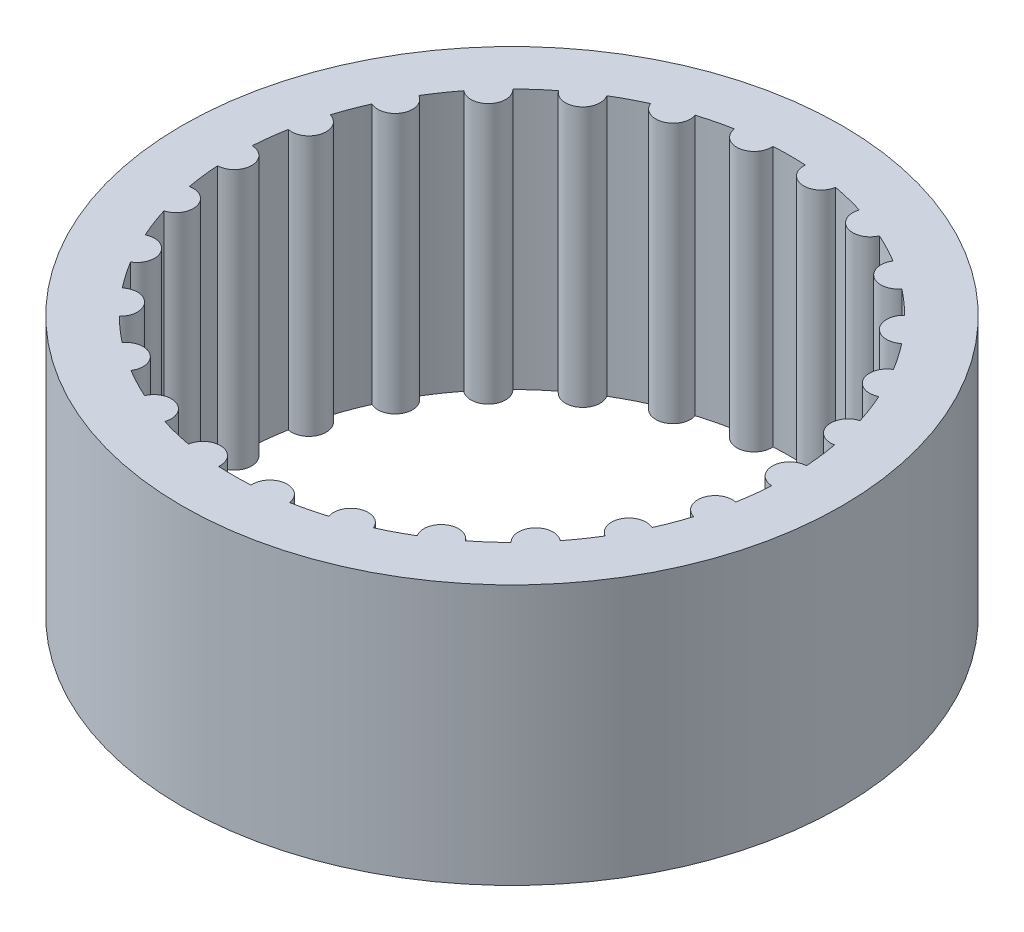
from build123d import *

# Parameters (mm, degrees)
BOSS_EXTRUDE1_DEPTH         = 10
BOSS_EXTRUDE1_DEPTH_BACK    = 10
SKETCH3_R                   = 1
BOSS_EXTRUDE1_2_DEPTH       = 10
BOSS_EXTRUDE1_2_DEPTH_BACK  = 10
SKETCH3_R_2                 = 0.999999994
BOSS_EXTRUDE1_3_DEPTH       = 10
BOSS_EXTRUDE1_3_DEPTH_BACK  = 10
BOSS_EXTRUDE1_4_DEPTH       = 10
BOSS_EXTRUDE1_4_DEPTH_BACK  = 10
BOSS_EXTRUDE1_5_DEPTH       = 10
BOSS_EXTRUDE1_5_DEPTH_BACK  = 10
BOSS_EXTRUDE1_6_DEPTH       = 10
BOSS_EXTRUDE1_6_DEPTH_BACK  = 10
BOSS_EXTRUDE1_7_DEPTH       = 10
BOSS_EXTRUDE1_7_DEPTH_BACK  = 10
BOSS_EXTRUDE1_8_DEPTH       = 10
BOSS_EXTRUDE1_8_DEPTH_BACK  = 10
BOSS_EXTRUDE1_9_DEPTH       = 10
BOSS_EXTRUDE1_9_DEPTH_BACK  = 10
BOSS_EXTRUDE1_10_DEPTH      = 10
BOSS_EXTRUDE1_10_DEPTH_BACK = 10
BOSS_EXTRUDE1_11_DEPTH      = 10
BOSS_EXTRUDE1_11_DEPTH_BACK = 10
BOSS_EXTRUDE1_12_DEPTH      = 10
BOSS_EXTRUDE1_12_DEPTH_BACK = 10
BOSS_EXTRUDE1_13_DEPTH      = 10
BOSS_EXTRUDE1_13_DEPTH_BACK = 10
BOSS_EXTRUDE1_14_DEPTH      = 10
BOSS_EXTRUDE1_14_DEPTH_BACK = 10
BOSS_EXTRUDE1_15_DEPTH      = 10
BOSS_EXTRUDE1_15_DEPTH_BACK = 10
BOSS_EXTRUDE1_16_DEPTH      = 10
BOSS_EXTRUDE1_16_DEPTH_BACK = 10
BOSS_EXTRUDE1_17_DEPTH      = 10
BOSS_EXTRUDE1_17_DEPTH_BACK = 10
BOSS_EXTRUDE1_18_DEPTH      = 10
BOSS_EXTRUDE1_18_DEPTH_BACK = 10
BOSS_EXTRUDE1_19_DEPTH      = 10
BOSS_EXTRUDE1_19_DEPTH_BACK = 10
BOSS_EXTRUDE1_20_DEPTH      = 10
BOSS_EXTRUDE1_20_DEPTH_BACK = 10
BOSS_EXTRUDE1_21_DEPTH      = 10
BOSS_EXTRUDE1_21_DEPTH_BACK = 10
BOSS_EXTRUDE1_22_DEPTH      = 10
BOSS_EXTRUDE1_22_DEPTH_BACK = 10
BOSS_EXTRUDE1_23_DEPTH      = 10
BOSS_EXTRUDE1_23_DEPTH_BACK = 10
BOSS_EXTRUDE1_24_DEPTH      = 10
BOSS_EXTRUDE1_24_DEPTH_BACK = 10
BOSS_EXTRUDE1_25_DEPTH      = 10
BOSS_EXTRUDE1_25_DEPTH_BACK = 10
BOSS_EXTRUDE1_26_DEPTH      = 10
BOSS_EXTRUDE1_26_DEPTH_BACK = 10
BOSS_EXTRUDE2_DEPTH         = 10
BOSS_EXTRUDE2_DEPTH_BACK    = 10
SKETCH4_R                   = 19
SKETCH4_R_2                 = 16
SKETCH5_R                   = 19
CUT_EXTRUDE2_DEPTH          = 2.5
SKETCH6_R                   = 19
CUT_EXTRUDE3_DEPTH          = 2.5


with BuildPart() as part:
    # Sketch3 → Boss-Extrude1 (new, two sides: drawn at the far end of the back side and taken through both)
    with BuildSketch(Plane(origin=(0, 0, 0), x_dir=(1, 0, 0), z_dir=(0, 1, 0)).offset(-BOSS_EXTRUDE1_DEPTH_BACK)):
        with Locations((15.5, 1.13e-07)):
            Circle(SKETCH3_R)
    extrude(amount=BOSS_EXTRUDE1_DEPTH + BOSS_EXTRUDE1_DEPTH_BACK)



with BuildPart() as body_2:
    # Sketch3 → Boss-Extrude1 2 (new, two sides: drawn at the far end of the back side and taken through both)
    with BuildSketch(Plane(origin=(0, 0, 0), x_dir=(1, 0, 0), z_dir=(0, 1, 0)).offset(-BOSS_EXTRUDE1_2_DEPTH_BACK)):
        with Locations((15.035069079, -3.829050516)):
            Circle(SKETCH3_R_2)
    extrude(amount=BOSS_EXTRUDE1_2_DEPTH + BOSS_EXTRUDE1_2_DEPTH_BACK)


with BuildPart() as body_3:
    # Sketch3 → Boss-Extrude1 3 (new, two sides: drawn at the far end of the back side and taken through both)
    with BuildSketch(Plane(origin=(0, 0, 0), x_dir=(1, 0, 0), z_dir=(0, 1, 0)).offset(-BOSS_EXTRUDE1_3_DEPTH_BACK)):
        with Locations((13.66729641, -7.43557064)):
            Circle(SKETCH3_R)
    extrude(amount=BOSS_EXTRUDE1_3_DEPTH + BOSS_EXTRUDE1_3_DEPTH_BACK)


with BuildPart() as body_4:
    # Sketch3 → Boss-Extrude1 4 (new, two sides: drawn at the far end of the back side and taken through both)
    with BuildSketch(Plane(origin=(0, 0, 0), x_dir=(1, 0, 0), z_dir=(0, 1, 0)).offset(-BOSS_EXTRUDE1_4_DEPTH_BACK)):
        with Locations((11.476171971, -10.609962419)):
            Circle(SKETCH3_R)
    extrude(amount=BOSS_EXTRUDE1_4_DEPTH + BOSS_EXTRUDE1_4_DEPTH_BACK)


with BuildPart() as body_5:
    # Sketch3 → Boss-Extrude1 5 (new, two sides: drawn at the far end of the back side and taken through both)
    with BuildSketch(Plane(origin=(0, 0, 0), x_dir=(1, 0, 0), z_dir=(0, 1, 0)).offset(-BOSS_EXTRUDE1_5_DEPTH_BACK)):
        with Locations((8.589035948, -13.167741741)):
            Circle(SKETCH3_R)
    extrude(amount=BOSS_EXTRUDE1_5_DEPTH + BOSS_EXTRUDE1_5_DEPTH_BACK)


with BuildPart() as body_6:
    # Sketch3 → Boss-Extrude1 6 (new, two sides: drawn at the far end of the back side and taken through both)
    with BuildSketch(Plane(origin=(0, 0, 0), x_dir=(1, 0, 0), z_dir=(0, 1, 0)).offset(-BOSS_EXTRUDE1_6_DEPTH_BACK)):
        with Locations((5.173678193, -14.96025977)):
            Circle(SKETCH3_R)
    extrude(amount=BOSS_EXTRUDE1_6_DEPTH + BOSS_EXTRUDE1_6_DEPTH_BACK)


with BuildPart() as body_7:
    # Sketch3 → Boss-Extrude1 7 (new, two sides: drawn at the far end of the back side and taken through both)
    with BuildSketch(Plane(origin=(0, 0, 0), x_dir=(1, 0, 0), z_dir=(0, 1, 0)).offset(-BOSS_EXTRUDE1_7_DEPTH_BACK)):
        with Locations((1.428586884, -15.883341873)):
            Circle(SKETCH3_R)
    extrude(amount=BOSS_EXTRUDE1_7_DEPTH + BOSS_EXTRUDE1_7_DEPTH_BACK)


with BuildPart() as body_8:
    # Sketch3 → Boss-Extrude1 8 (new, two sides: drawn at the far end of the back side and taken through both)
    with BuildSketch(Plane(origin=(0, 0, 0), x_dir=(1, 0, 0), z_dir=(0, 1, 0)).offset(-BOSS_EXTRUDE1_8_DEPTH_BACK)):
        with Locations((-2.428586884, -15.883341873)):
            Circle(SKETCH3_R)
    extrude(amount=BOSS_EXTRUDE1_8_DEPTH + BOSS_EXTRUDE1_8_DEPTH_BACK)


with BuildPart() as body_9:
    # Sketch3 → Boss-Extrude1 9 (new, two sides: drawn at the far end of the back side and taken through both)
    with BuildSketch(Plane(origin=(0, 0, 0), x_dir=(1, 0, 0), z_dir=(0, 1, 0)).offset(-BOSS_EXTRUDE1_9_DEPTH_BACK)):
        with Locations((-6.173678193, -14.96025977)):
            Circle(SKETCH3_R)
    extrude(amount=BOSS_EXTRUDE1_9_DEPTH + BOSS_EXTRUDE1_9_DEPTH_BACK)


with BuildPart() as body_10:
    # Sketch3 → Boss-Extrude1 10 (new, two sides: drawn at the far end of the back side and taken through both)
    with BuildSketch(Plane(origin=(0, 0, 0), x_dir=(1, 0, 0), z_dir=(0, 1, 0)).offset(-BOSS_EXTRUDE1_10_DEPTH_BACK)):
        with Locations((-9.589035948, -13.167741741)):
            Circle(SKETCH3_R)
    extrude(amount=BOSS_EXTRUDE1_10_DEPTH + BOSS_EXTRUDE1_10_DEPTH_BACK)


with BuildPart() as body_11:
    # Sketch3 → Boss-Extrude1 11 (new, two sides: drawn at the far end of the back side and taken through both)
    with BuildSketch(Plane(origin=(0, 0, 0), x_dir=(1, 0, 0), z_dir=(0, 1, 0)).offset(-BOSS_EXTRUDE1_11_DEPTH_BACK)):
        with Locations((-12.476171971, -10.609962419)):
            Circle(SKETCH3_R)
    extrude(amount=BOSS_EXTRUDE1_11_DEPTH + BOSS_EXTRUDE1_11_DEPTH_BACK)


with BuildPart() as body_12:
    # Sketch3 → Boss-Extrude1 12 (new, two sides: drawn at the far end of the back side and taken through both)
    with BuildSketch(Plane(origin=(0, 0, 0), x_dir=(1, 0, 0), z_dir=(0, 1, 0)).offset(-BOSS_EXTRUDE1_12_DEPTH_BACK)):
        with Locations((-14.66729641, -7.43557064)):
            Circle(SKETCH3_R)
    extrude(amount=BOSS_EXTRUDE1_12_DEPTH + BOSS_EXTRUDE1_12_DEPTH_BACK)


with BuildPart() as body_13:
    # Sketch3 → Boss-Extrude1 13 (new, two sides: drawn at the far end of the back side and taken through both)
    with BuildSketch(Plane(origin=(0, 0, 0), x_dir=(1, 0, 0), z_dir=(0, 1, 0)).offset(-BOSS_EXTRUDE1_13_DEPTH_BACK)):
        with Locations((-16.035069079, -3.829050516)):
            Circle(SKETCH3_R)
    extrude(amount=BOSS_EXTRUDE1_13_DEPTH + BOSS_EXTRUDE1_13_DEPTH_BACK)


with BuildPart() as body_14:
    # Sketch3 → Boss-Extrude1 14 (new, two sides: drawn at the far end of the back side and taken through both)
    with BuildSketch(Plane(origin=(0, 0, 0), x_dir=(1, 0, 0), z_dir=(0, 1, 0)).offset(-BOSS_EXTRUDE1_14_DEPTH_BACK)):
        with Locations((-16.5, 1.13e-07)):
            Circle(SKETCH3_R)
    extrude(amount=BOSS_EXTRUDE1_14_DEPTH + BOSS_EXTRUDE1_14_DEPTH_BACK)


with BuildPart() as body_15:
    # Sketch3 → Boss-Extrude1 15 (new, two sides: drawn at the far end of the back side and taken through both)
    with BuildSketch(Plane(origin=(0, 0, 0), x_dir=(1, 0, 0), z_dir=(0, 1, 0)).offset(-BOSS_EXTRUDE1_15_DEPTH_BACK)):
        with Locations((-16.035069079, 3.829050742)):
            Circle(SKETCH3_R_2)
    extrude(amount=BOSS_EXTRUDE1_15_DEPTH + BOSS_EXTRUDE1_15_DEPTH_BACK)


with BuildPart() as body_16:
    # Sketch3 → Boss-Extrude1 16 (new, two sides: drawn at the far end of the back side and taken through both)
    with BuildSketch(Plane(origin=(0, 0, 0), x_dir=(1, 0, 0), z_dir=(0, 1, 0)).offset(-BOSS_EXTRUDE1_16_DEPTH_BACK)):
        with Locations((-14.66729641, 7.435570866)):
            Circle(SKETCH3_R)
    extrude(amount=BOSS_EXTRUDE1_16_DEPTH + BOSS_EXTRUDE1_16_DEPTH_BACK)


with BuildPart() as body_17:
    # Sketch3 → Boss-Extrude1 17 (new, two sides: drawn at the far end of the back side and taken through both)
    with BuildSketch(Plane(origin=(0, 0, 0), x_dir=(1, 0, 0), z_dir=(0, 1, 0)).offset(-BOSS_EXTRUDE1_17_DEPTH_BACK)):
        with Locations((-12.476171971, 10.609962645)):
            Circle(SKETCH3_R)
    extrude(amount=BOSS_EXTRUDE1_17_DEPTH + BOSS_EXTRUDE1_17_DEPTH_BACK)


with BuildPart() as body_18:
    # Sketch3 → Boss-Extrude1 18 (new, two sides: drawn at the far end of the back side and taken through both)
    with BuildSketch(Plane(origin=(0, 0, 0), x_dir=(1, 0, 0), z_dir=(0, 1, 0)).offset(-BOSS_EXTRUDE1_18_DEPTH_BACK)):
        with Locations((-9.589035948, 13.167741967)):
            Circle(SKETCH3_R)
    extrude(amount=BOSS_EXTRUDE1_18_DEPTH + BOSS_EXTRUDE1_18_DEPTH_BACK)


with BuildPart() as body_19:
    # Sketch3 → Boss-Extrude1 19 (new, two sides: drawn at the far end of the back side and taken through both)
    with BuildSketch(Plane(origin=(0, 0, 0), x_dir=(1, 0, 0), z_dir=(0, 1, 0)).offset(-BOSS_EXTRUDE1_19_DEPTH_BACK)):
        with Locations((-6.173678193, 14.960259996)):
            Circle(SKETCH3_R)
    extrude(amount=BOSS_EXTRUDE1_19_DEPTH + BOSS_EXTRUDE1_19_DEPTH_BACK)


with BuildPart() as body_20:
    # Sketch3 → Boss-Extrude1 20 (new, two sides: drawn at the far end of the back side and taken through both)
    with BuildSketch(Plane(origin=(0, 0, 0), x_dir=(1, 0, 0), z_dir=(0, 1, 0)).offset(-BOSS_EXTRUDE1_20_DEPTH_BACK)):
        with Locations((-2.428586884, 15.883342099)):
            Circle(SKETCH3_R)
    extrude(amount=BOSS_EXTRUDE1_20_DEPTH + BOSS_EXTRUDE1_20_DEPTH_BACK)


with BuildPart() as body_21:
    # Sketch3 → Boss-Extrude1 21 (new, two sides: drawn at the far end of the back side and taken through both)
    with BuildSketch(Plane(origin=(0, 0, 0), x_dir=(1, 0, 0), z_dir=(0, 1, 0)).offset(-BOSS_EXTRUDE1_21_DEPTH_BACK)):
        with Locations((1.428586884, 15.883342099)):
            Circle(SKETCH3_R)
    extrude(amount=BOSS_EXTRUDE1_21_DEPTH + BOSS_EXTRUDE1_21_DEPTH_BACK)


with BuildPart() as body_22:
    # Sketch3 → Boss-Extrude1 22 (new, two sides: drawn at the far end of the back side and taken through both)
    with BuildSketch(Plane(origin=(0, 0, 0), x_dir=(1, 0, 0), z_dir=(0, 1, 0)).offset(-BOSS_EXTRUDE1_22_DEPTH_BACK)):
        with Locations((5.173678193, 14.960259996)):
            Circle(SKETCH3_R)
    extrude(amount=BOSS_EXTRUDE1_22_DEPTH + BOSS_EXTRUDE1_22_DEPTH_BACK)


with BuildPart() as body_23:
    # Sketch3 → Boss-Extrude1 23 (new, two sides: drawn at the far end of the back side and taken through both)
    with BuildSketch(Plane(origin=(0, 0, 0), x_dir=(1, 0, 0), z_dir=(0, 1, 0)).offset(-BOSS_EXTRUDE1_23_DEPTH_BACK)):
        with Locations((8.589035948, 13.167741967)):
            Circle(SKETCH3_R)
    extrude(amount=BOSS_EXTRUDE1_23_DEPTH + BOSS_EXTRUDE1_23_DEPTH_BACK)


with BuildPart() as body_24:
    # Sketch3 → Boss-Extrude1 24 (new, two sides: drawn at the far end of the back side and taken through both)
    with BuildSketch(Plane(origin=(0, 0, 0), x_dir=(1, 0, 0), z_dir=(0, 1, 0)).offset(-BOSS_EXTRUDE1_24_DEPTH_BACK)):
        with Locations((11.476171971, 10.609962645)):
            Circle(SKETCH3_R)
    extrude(amount=BOSS_EXTRUDE1_24_DEPTH + BOSS_EXTRUDE1_24_DEPTH_BACK)


with BuildPart() as body_25:
    # Sketch3 → Boss-Extrude1 25 (new, two sides: drawn at the far end of the back side and taken through both)
    with BuildSketch(Plane(origin=(0, 0, 0), x_dir=(1, 0, 0), z_dir=(0, 1, 0)).offset(-BOSS_EXTRUDE1_25_DEPTH_BACK)):
        with Locations((13.66729641, 7.435570866)):
            Circle(SKETCH3_R)
    extrude(amount=BOSS_EXTRUDE1_25_DEPTH + BOSS_EXTRUDE1_25_DEPTH_BACK)


with BuildPart() as body_26:
    # Sketch3 → Boss-Extrude1 26 (new, two sides: drawn at the far end of the back side and taken through both)
    with BuildSketch(Plane(origin=(0, 0, 0), x_dir=(1, 0, 0), z_dir=(0, 1, 0)).offset(-BOSS_EXTRUDE1_26_DEPTH_BACK)):
        with Locations((15.035069079, 3.829050742)):
            Circle(SKETCH3_R)
    extrude(amount=BOSS_EXTRUDE1_26_DEPTH + BOSS_EXTRUDE1_26_DEPTH_BACK)


with BuildPart() as part_1:
    add(part.part)

    add(body_2.part)  # Boss-Extrude2 merges body 2

    add(body_3.part)  # Boss-Extrude2 merges body 3

    add(body_4.part)  # Boss-Extrude2 merges body 4

    add(body_5.part)  # Boss-Extrude2 merges body 5

    add(body_6.part)  # Boss-Extrude2 merges body 6

    add(body_7.part)  # Boss-Extrude2 merges body 7

    add(body_8.part)  # Boss-Extrude2 merges body 8

    add(body_9.part)  # Boss-Extrude2 merges body 9

    add(body_10.part)  # Boss-Extrude2 merges body 10

    add(body_11.part)  # Boss-Extrude2 merges body 11

    add(body_12.part)  # Boss-Extrude2 merges body 12

    add(body_13.part)  # Boss-Extrude2 merges body 13

    add(body_14.part)  # Boss-Extrude2 merges body 14

    add(body_15.part)  # Boss-Extrude2 merges body 15

    add(body_16.part)  # Boss-Extrude2 merges body 16

    add(body_17.part)  # Boss-Extrude2 merges body 17

    add(body_18.part)  # Boss-Extrude2 merges body 18

    add(body_19.part)  # Boss-Extrude2 merges body 19

    add(body_20.part)  # Boss-Extrude2 merges body 20

    add(body_21.part)  # Boss-Extrude2 merges body 21

    add(body_22.part)  # Boss-Extrude2 merges body 22

    add(body_23.part)  # Boss-Extrude2 merges body 23

    add(body_24.part)  # Boss-Extrude2 merges body 24

    add(body_25.part)  # Boss-Extrude2 merges body 25

    add(body_26.part)  # Boss-Extrude2 merges body 26
    # Sketch4 → Boss-Extrude2 (add, two sides: drawn at the far end of the back side and taken through both)
    with BuildSketch(Plane(origin=(0, 0, 0), x_dir=(1, 0, 0), z_dir=(0, 1, 0)).offset(-BOSS_EXTRUDE2_DEPTH_BACK)):
        with Locations((-0.5, 0)):
            Circle(SKETCH4_R)
        with Locations((-0.5, 0)):
            Circle(SKETCH4_R_2, mode=Mode.SUBTRACT)
    extrude(amount=BOSS_EXTRUDE2_DEPTH + BOSS_EXTRUDE2_DEPTH_BACK)

    # Sketch5 → Cut-Extrude2 (cut)
    with BuildSketch(Plane(origin=(0, 10, 0), x_dir=(1, 0, 0), z_dir=(0, 1, 0))):
        with Locations((-0.5, 0)):
            Circle(SKETCH5_R)
    extrude(amount=-CUT_EXTRUDE2_DEPTH, mode=Mode.SUBTRACT)

    # Sketch6 → Cut-Extrude3 (cut)
    with BuildSketch(Plane.XZ.offset(10)):
        with Locations((-0.5, 0)):
            Circle(SKETCH6_R)
    extrude(amount=-CUT_EXTRUDE3_DEPTH, mode=Mode.SUBTRACT)


solid = part_1.part
